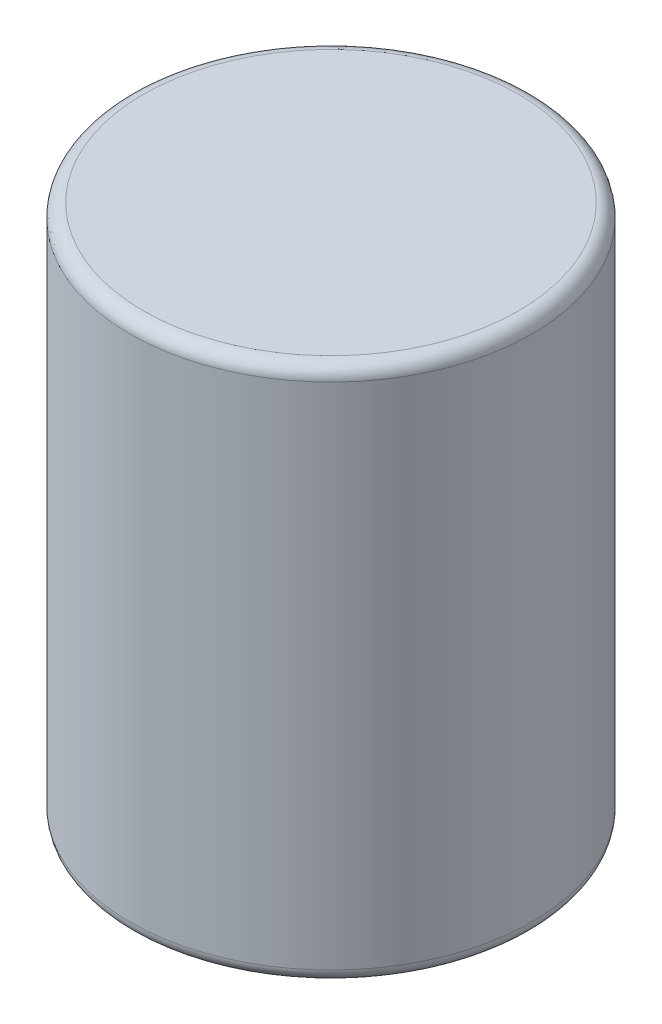
from build123d import *

# Parameters (mm, degrees)
SKETCH1_R           = 1.5
BOSS_EXTRUDE1_DEPTH = 4
FILLET1_R           = 0.1


with BuildPart() as part:
    # Sketch1 → Boss-Extrude1 (new body)
    with BuildSketch(Plane(origin=(0, 0, 0), x_dir=(1, 0, 0), z_dir=(0, 1, 0))):
        Circle(SKETCH1_R)
    extrude(amount=BOSS_EXTRUDE1_DEPTH)

    # Fillet1
    fillet1_edges = [part.edges().sort_by_distance(p)[0] for p in [
        (-1.5, 0, 0),
        (-1.5, 4, 0),
    ]]
    fillet(fillet1_edges, radius=FILLET1_R)


solid = part.part
